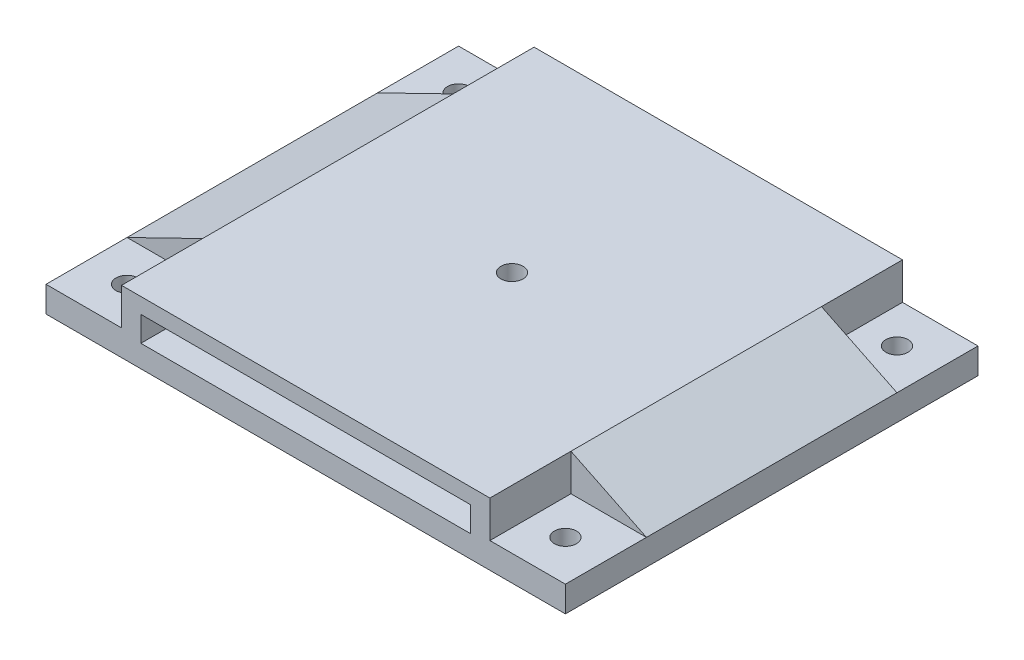
from build123d import *

# Parameters (mm, degrees)
SKETCH1_W               = 100
SKETCH1_H               = 112
BOSS_EXTRUDE1_DEPTH     = 17
SKETCH1_3_W             = 20.5
SKETCH1_3_H             = 112
SKETCH1_3_R             = 3
BOSS_EXTRUDE2_DEPTH     = 7
BOSS_EXTRUDE4_START     = -22
BOSS_EXTRUDE4_DEPTH     = 68
BOSS_EXTRUDE4_2_DEPTH   = 68
SKETCH6_W               = 89.5
SKETCH6_H               = 6.8
CUT_EXTRUDE1_DEPTH      = 134.428819975
CUT_EXTRUDE2_DEPTH      = 92.62559686
CUT_EXTRUDE2_DEPTH_BACK = 92.62559686
SKETCH7_R               = 3


with BuildPart() as part:
    # Sketch1 → Boss-Extrude1 (new body)
    with BuildSketch(Plane(origin=(0, 0, 0), x_dir=(1, 0, 0), z_dir=(0, 1, 0))):
        Rectangle(SKETCH1_W, SKETCH1_H)
    extrude(amount=BOSS_EXTRUDE1_DEPTH)

    # Sketch1<3> → Boss-Extrude2 (add)
    # profile 1 of 2: a face of its own
    with BuildSketch(Plane(origin=(0, 0, 0), x_dir=(1, 0, 0), z_dir=(0, 1, 0))):
        with Locations((-60.25, 0)):
            Rectangle(SKETCH1_3_W, SKETCH1_3_H)
        with Locations((-59.5, -45)):
            Circle(SKETCH1_3_R, mode=Mode.SUBTRACT)
        with Locations((-59.5, 45)):
            Circle(SKETCH1_3_R, mode=Mode.SUBTRACT)
    # profile 2 of 2: a face of its own
    with BuildSketch(Plane(origin=(0, 0, 0), x_dir=(1, 0, 0), z_dir=(0, 1, 0))):
        with Locations((60.25, 0)):
            Rectangle(SKETCH1_3_W, SKETCH1_3_H)
        with Locations((59.5, -45)):
            Circle(SKETCH1_3_R, mode=Mode.SUBTRACT)
        with Locations((59.5, 45)):
            Circle(SKETCH1_3_R, mode=Mode.SUBTRACT)
    extrude(amount=BOSS_EXTRUDE2_DEPTH)

    # Sketch6 → Cut-Extrude1 (cut, through all)
    with BuildSketch(Plane.XY.offset(56)):
        with Locations((0, 9.4)):
            Rectangle(SKETCH6_W, SKETCH6_H)
    extrude(amount=-CUT_EXTRUDE1_DEPTH, mode=Mode.SUBTRACT)

    # Sketch7 → Cut-Extrude2 (cut, two sides: drawn at the far end of the back side and taken through both)
    with BuildSketch(Plane(origin=(0, 17, 0), x_dir=(1, 0, 0), z_dir=(0, 1, 0)).offset(-CUT_EXTRUDE2_DEPTH_BACK)):
        Circle(SKETCH7_R)
    extrude(amount=CUT_EXTRUDE2_DEPTH + CUT_EXTRUDE2_DEPTH_BACK, mode=Mode.SUBTRACT)


with BuildPart() as body_2:
    # Sketch3 → Boss-Extrude4 (new body)
    with BuildSketch(Plane.XY.offset(56).offset(BOSS_EXTRUDE4_START)):
        Polygon((50, 17), (70.5, 7), (50, 7), align=None)
    extrude(amount=-BOSS_EXTRUDE4_DEPTH)


with BuildPart() as body_3:
    # Sketch3 → Boss-Extrude4 2 (new body)
    with BuildSketch(Plane.XY.offset(56).offset(BOSS_EXTRUDE4_START)):
        Polygon((-50, 17), (-50, 7), (-70.5, 7), align=None)
    extrude(amount=-BOSS_EXTRUDE4_2_DEPTH)


solid = Compound([part.part, body_2.part, body_3.part])
